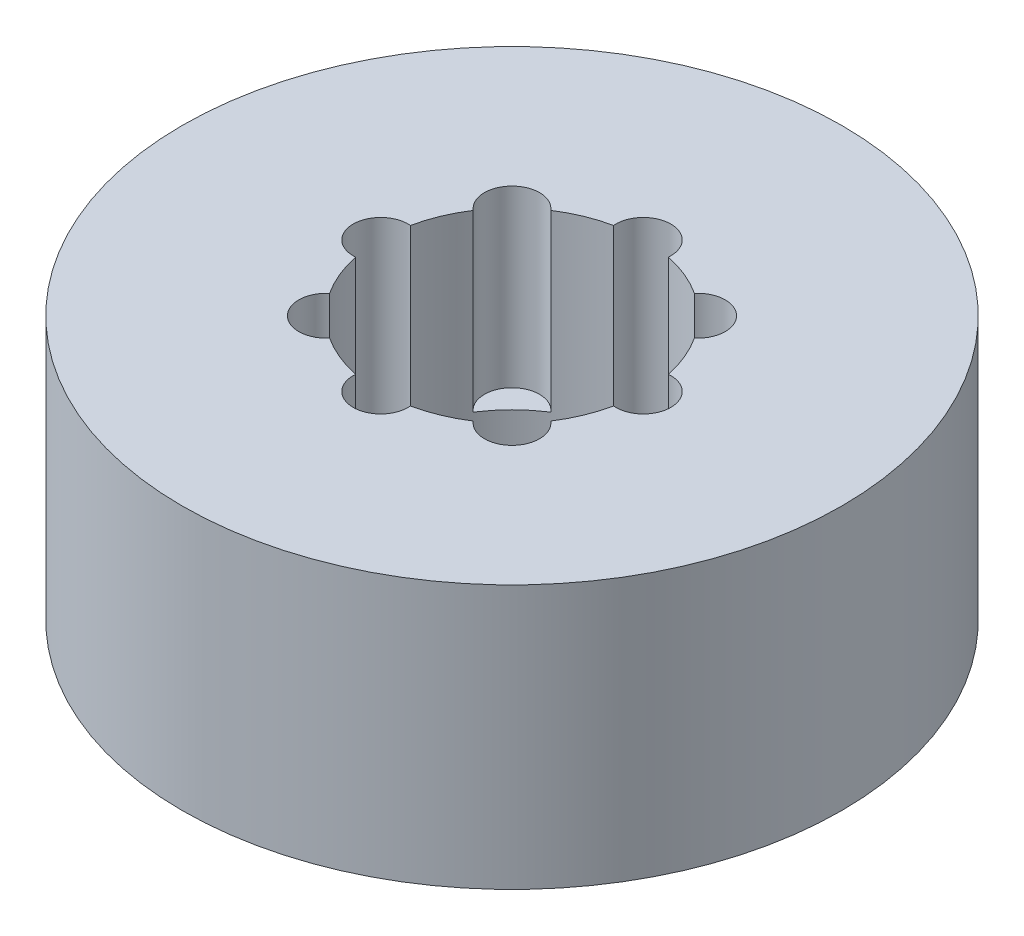
from build123d import *

# Parameters (mm, degrees)
SKETCH1_R           = 25
BOSS_EXTRUDE1_DEPTH = 20
SKETCH2_R           = 10
CUT_EXTRUDE1_DEPTH  = 41.620192023
SKETCH3_R           = 2.087006148
CUT_EXTRUDE2_DEPTH  = 13.24495835
CIRPATTERN1_COUNT   = 8


with BuildPart() as part:
    # Sketch1 → Boss-Extrude1 (new body)
    with BuildSketch(Plane(origin=(0, 0, 0), x_dir=(1, 0, 0), z_dir=(0, 1, 0))):
        Circle(SKETCH1_R)
    extrude(amount=BOSS_EXTRUDE1_DEPTH)

    # Sketch2 → Cut-Extrude1 (cut, through all)
    with BuildSketch(Plane(origin=(0, 0, 0), x_dir=(1, 0, 0), z_dir=(0, 1, 0))):
        Circle(SKETCH2_R)
    extrude(amount=CUT_EXTRUDE1_DEPTH, mode=Mode.SUBTRACT)

    # Sketch3 → Cut-Extrude2 (cut)
    with BuildSketch(Plane(origin=(0, 20, 0), x_dir=(1, 0, 0), z_dir=(0, 1, 0))):
        with Locations((-9.957561581, 0)):
            Circle(SKETCH3_R)
    cut_extrude2 = extrude(amount=-CUT_EXTRUDE2_DEPTH, mode=Mode.SUBTRACT)

    # CirPattern1: Cut-Extrude2 ×8 about axis
    cirpattern1_axis = Axis((0, 0, 0), (0, 1, 0))
    for i in range(1, CIRPATTERN1_COUNT):
        add(cut_extrude2.rotate(cirpattern1_axis, i * 360 / CIRPATTERN1_COUNT), mode=Mode.SUBTRACT)


solid = part.part
